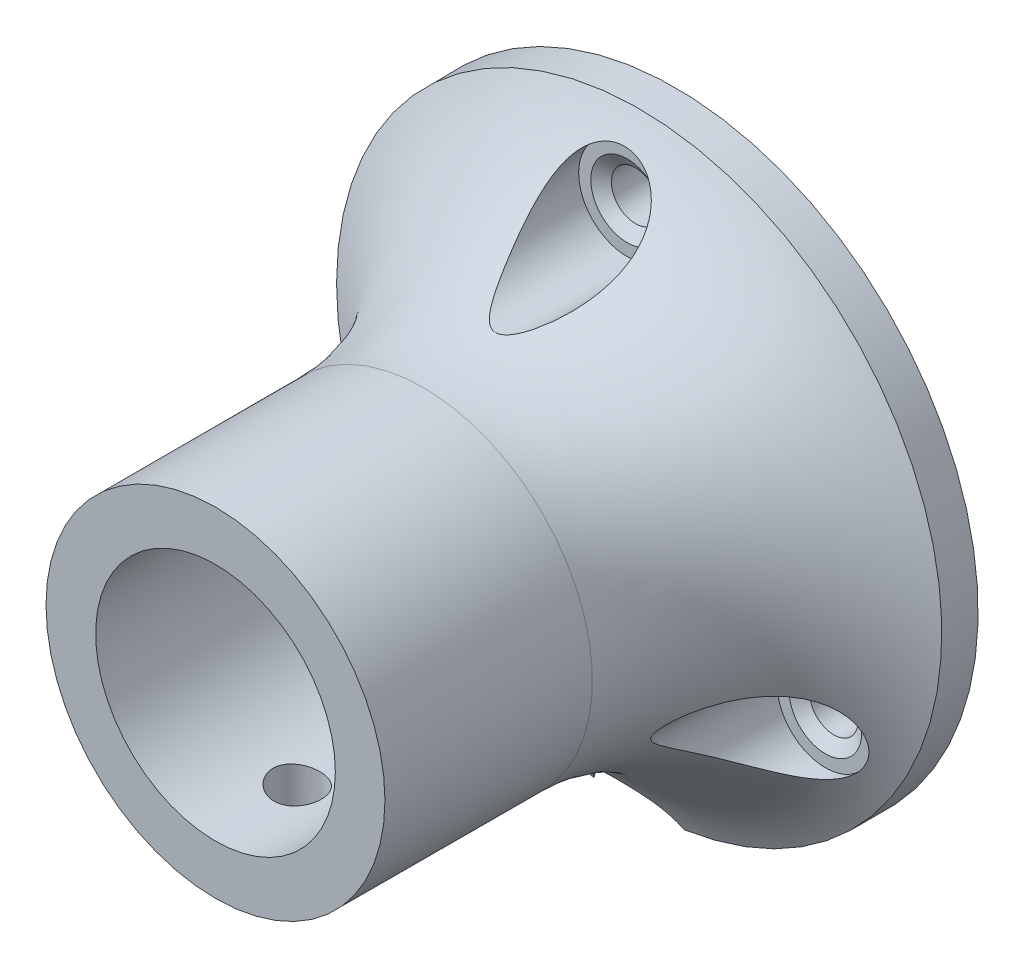
from build123d import *
from OCP.BRepFilletAPI import BRepFilletAPI_MakeChamfer

# Parameters (mm, degrees)
SKETCH1_R           = 25
SKETCH1_R_2         = 14
SKETCH1_R_3         = 9.9
BOSS_EXTRUDE1_DEPTH = 3
SKETCH2_R           = 14
SKETCH2_R_2         = 9.9
BOSS_EXTRUDE2_DEPTH = 35
FILLET1_R           = 20
SKETCH3_R           = 2
CUT_EXTRUDE1_DEPTH  = 35
CUT_EXTRUDE2_START  = -4
SKETCH4_R           = 4
CUT_EXTRUDE2_DEPTH  = 18
CHAMFER1_SIZE       = 1
CHAMFER1_SIZE2      = 0.700207538
CUT_EXTRUDE3_REACH  = 53.904
SKETCH5_R           = 2
SKETCH5_R_2         = 4.790081367


with BuildPart() as part:
    # Sketch1 → Boss-Extrude1 (new body)
    # profile 1 of 2: a face of its own
    with BuildSketch(Plane.XY):
        Circle(SKETCH1_R)
        Circle(SKETCH1_R_2, mode=Mode.SUBTRACT)
    # profile 2 of 2: a face of its own
    with BuildSketch(Plane.XY):
        Circle(SKETCH1_R_2)
        Circle(SKETCH1_R_3, mode=Mode.SUBTRACT)
    extrude(amount=BOSS_EXTRUDE1_DEPTH)

    # Sketch2 → Boss-Extrude2 (add)
    with BuildSketch(Plane.XY.offset(3)):
        Circle(SKETCH2_R)
        Circle(SKETCH2_R_2, mode=Mode.SUBTRACT)
    extrude(amount=BOSS_EXTRUDE2_DEPTH)

    # Fillet1
    # the kernel refuses this fillet: 20 mm, written as the material it adds along each edge
    with BuildSketch(Plane(origin=(0, 0, 3), x_dir=(1, 0, 0), z_dir=(0, -1, 0))) as fillet1_piece_1:
        with BuildLine():
            CenterArc((34, 17.860571099), FILLET1_R, 180, 63.25631605)
            Line((14, 17.860571099), (13.6, 17.860571099))
            Line((13.6, 17.860571099), (13.6, 0))
            Line((13.6, 0), (14, -0.4))
            ThreePointArc((14, -0.4), (19.5, -0.4), (24.82, -0.357211422))
            Line((24.82, -0.357211422), (25, 0))
        make_face()
    revolve(axis=Axis((0, 0, 3), (0, 0, 1)))

    # Sketch3 → Cut-Extrude1 (cut)
    with BuildSketch(Plane(origin=(0, 0, 0), x_dir=(-1, 0, 0), z_dir=(0, 0, -1))):
        with Locations((0, 18.918658527)):
            Circle(SKETCH3_R)
        with Locations((16.38403889, -9.459329263)):
            Circle(SKETCH3_R)
        with Locations((-16.38403889, -9.459329263)):
            Circle(SKETCH3_R)
    extrude(amount=-CUT_EXTRUDE1_DEPTH, mode=Mode.SUBTRACT)

    # Sketch4 → Cut-Extrude2 (cut)
    with BuildSketch(Plane(origin=(0, 0, 0), x_dir=(-1, 0, 0), z_dir=(0, 0, -1)).offset(CUT_EXTRUDE2_START)):
        with Locations((-16.38403889, -9.459329263)):
            Circle(SKETCH4_R)
        with Locations((0, 18.918658527)):
            Circle(SKETCH4_R)
        with Locations((16.38403889, -9.459329263)):
            Circle(SKETCH4_R)
    extrude(amount=-CUT_EXTRUDE2_DEPTH, mode=Mode.SUBTRACT)

    # Chamfer1: one chamfer whose edges measure the first distance from different faces: ONE call of the kernel's chamfer builder (chamfer() names one face for all edges)
    chamfer1_edges_1 = [part.edges().sort_by_distance(p)[0] for p in [
        (18.38403889, -9.459329263, 4),
    ]]
    chamfer1_side_1 = [part.faces().sort_by_distance(p)[0] for p in [
        (20.270901805, -9.459329263, 4),
    ]]
    chamfer1_edges_2 = [part.edges().sort_by_distance(p)[0] for p in [
        (2, 18.918658527, 4),
    ]]
    chamfer1_side_2 = [part.faces().sort_by_distance(p)[0] for p in [
        (3.886862915, 18.918658527, 4),
    ]]
    chamfer1_edges_3 = [part.edges().sort_by_distance(p)[0] for p in [
        (-14.38403889, -9.459329263, 4),
    ]]
    chamfer1_side_3 = [part.faces().sort_by_distance(p)[0] for p in [
        (-12.497175975, -9.459329263, 4),
    ]]
    chamfer1 = BRepFilletAPI_MakeChamfer(part.part.solid().wrapped)
    for e in chamfer1_edges_1:
        chamfer1.Add(CHAMFER1_SIZE, CHAMFER1_SIZE2, e.wrapped, chamfer1_side_1[0].wrapped)  # the first distance lies on this face
    for e in chamfer1_edges_2:
        chamfer1.Add(CHAMFER1_SIZE, CHAMFER1_SIZE2, e.wrapped, chamfer1_side_2[0].wrapped)  # the first distance lies on this face
    for e in chamfer1_edges_3:
        chamfer1.Add(CHAMFER1_SIZE, CHAMFER1_SIZE2, e.wrapped, chamfer1_side_3[0].wrapped)  # the first distance lies on this face
    add(Compound.cast(chamfer1.Shape()), mode=Mode.REPLACE)

    # Sketch5 → Cut-Extrude3 (cut, up to next)
    with BuildSketch(Plane(origin=(0, 0, 0), x_dir=(1, 0, 0), z_dir=(0, 1, 0)), mode=Mode.PRIVATE) as cut_extrude3_sk1:
        with Locations(Location((-0.515660085, -30.731266932, 0), (0, 0, 270))):
            Circle(SKETCH5_R)
    cut_extrude3_tool1 = extrude(cut_extrude3_sk1.sketch, amount=-CUT_EXTRUDE3_REACH, mode=Mode.PRIVATE) & part.part
    # Sketch5 → Cut-Extrude3 (cut, up to next)
    with BuildSketch(Plane(origin=(0, 0, 0), x_dir=(1, 0, 0), z_dir=(0, 1, 0)), mode=Mode.PRIVATE) as cut_extrude3_sk2:
        Circle(SKETCH5_R_2)
    cut_extrude3_tool2 = extrude(cut_extrude3_sk2.sketch, amount=-CUT_EXTRUDE3_REACH, mode=Mode.PRIVATE) & part.part
    add(cut_extrude3_tool1.solids().sort_by_distance((-0.51566, 0, 30.731267))[0], mode=Mode.SUBTRACT)
    add(cut_extrude3_tool2.solids().sort_by_distance((0, 0, 0))[0], mode=Mode.SUBTRACT)


solid = part.part
